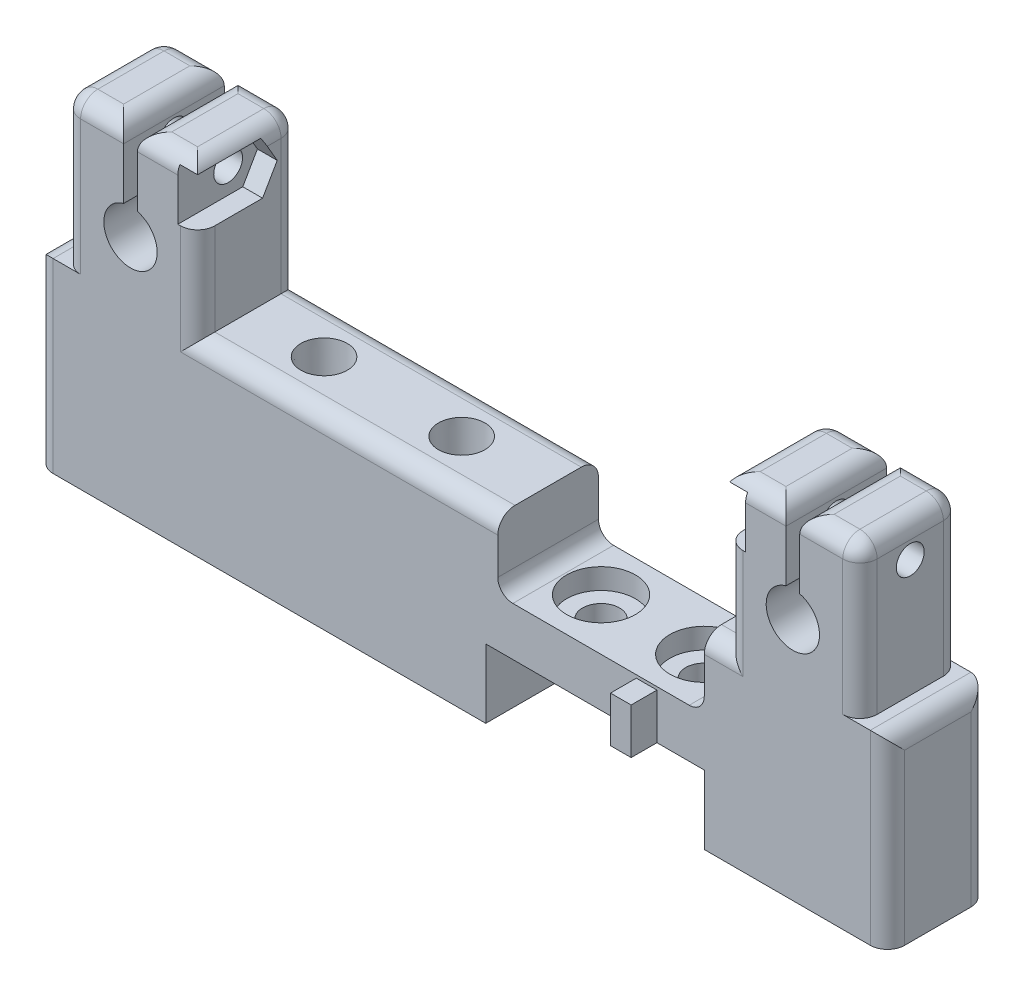
from build123d import *
from OCP.BRepFilletAPI import BRepFilletAPI_MakeChamfer
from build123d.topology import SkipClean

# Parameters (mm, degrees)
SKETCH1_R                      = 3.1
SKETCH1_R_2                    = 3.5
SKETCH1_W                      = 32
SKETCH1_H                      = 15.65
BOSS_EXTRUDE1_DEPTH            = 11.7
CUT_EXTRUDE5_DEPTH             = 14
CUT_EXTRUDE8_REACH             = 96.23
SKETCH10_R                     = 1.675
CUT_EXTRUDE8_DIRECTION_2_REACH = 96.23
CUT_EXTRUDE9_REACH             = 94.724
SKETCH11_R                     = 1.625
CUT_EXTRUDE9_DIRECTION_2_REACH = 94.724
CUT_EXTRUDE10_DEPTH            = 2.3
CUT_EXTRUDE11_DEPTH            = 2.3
HOLE1_D                        = 4.8
HOLE1_DEPTH                    = 12
HOLE1_CBORE_D                  = 5.4
HOLE1_CBORE_DEPTH              = 6
CUT_EXTRUDE17_REACH            = 66.001
SKETCH30_W                     = 59.4
SKETCH30_H                     = 25.65
SKETCH32_W                     = 99
SKETCH32_H                     = 8
CUT_EXTRUDE20_DEPTH            = 65.000566
CHAMFER1_SIZE                  = 6
CHAMFER1_SIZE_2                = 0.3
FILLET1_R                      = 2
SKETCH33_W                     = 2.4
SKETCH33_H                     = 5.3
BOSS_EXTRUDE2_DEPTH            = 3
SKETCH34_W                     = 99
SKETCH34_H                     = 8
CUT_EXTRUDE21_DEPTH            = 61.759087
CUT_EXTRUDE22_START            = -11.7
CUT_EXTRUDE22_DEPTH            = 11.7
BOSS_EXTRUDE4_DEPTH            = 8
SKETCH45_W                     = 25.4
SKETCH45_H                     = 8
CUT_EXTRUDE26_DEPTH            = 62.407383
M4_CLEARANCE_HOLE1_D           = 4.3
SKETCH46_2_R                   = 4
CUT_EXTRUDE27_DEPTH            = 2.4
FILLET5_R                      = 1.75


# Some blends are built 0.0001 mm under size
with BuildPart() as part:
    # Sketch1 → Boss-Extrude1 (new body)
    with BuildSketch(Plane.XY):
        Polygon((-43.30318, 29.275361), (25.69682, 29.275361), (55.69682, 29.275361), (55.69682, -18.024639), (-43.30318, -18.024639), align=None)
        with Locations((-32.30318, 10.275361)):
            Circle(SKETCH1_R, mode=Mode.SUBTRACT)
        with Locations((44.69682, 10.275361)):
            Circle(SKETCH1_R, mode=Mode.SUBTRACT)
        with Locations((22.69682, 12.275361)):
            Circle(SKETCH1_R_2, mode=Mode.SUBTRACT)
        with Locations((-6.80318, 11.450361)):
            Rectangle(SKETCH1_W, SKETCH1_H, mode=Mode.SUBTRACT)
    extrude(amount=-BOSS_EXTRUDE1_DEPTH)

    # Sketch7 → Cut-Extrude5 (cut)
    with BuildSketch(Plane.XY):
        with BuildLine():
            Line((-43.30318, 22.775361), (-22.50318, 22.775361))
            Line((-22.50318, 22.775361), (-22.50318, 3.625361))
            Line((-22.50318, 3.625361), (-24.50318, 3.625361))
            Line((-24.50318, 3.625361), (-24.50318, 21.275361))
            Line((-24.50318, 21.275361), (-31.50318, 21.275361))
            Line((-31.50318, 21.275361), (-31.50318, 13.270357))
            ThreePointArc((-31.50318, 13.270357), (-32.30318, 7.175361), (-33.10318, 13.270357))
            Line((-33.10318, 13.270357), (-33.10318, 21.275361))
            Line((-33.10318, 21.275361), (-40.10318, 21.275361))
            Line((-40.10318, 21.275361), (-40.10318, 3.625361))
            Line((-40.10318, 3.625361), (-43.30318, 3.625361))
            Line((-43.30318, 3.625361), (-43.30318, 22.775361))
        make_face()
        with BuildLine():
            Line((34.89682, 22.775361), (55.69682, 22.775361))
            Line((55.69682, 22.775361), (55.69682, 3.625361))
            Line((55.69682, 3.625361), (52.49682, 3.625361))
            Line((52.49682, 3.625361), (52.49682, 21.275361))
            Line((52.49682, 21.275361), (45.49682, 21.275361))
            Line((45.49682, 21.275361), (45.49682, 13.270357))
            ThreePointArc((45.49682, 13.270357), (44.69682, 7.175361), (43.89682, 13.270357))
            Line((43.89682, 13.270357), (43.89682, 21.275361))
            Line((43.89682, 21.275361), (36.89682, 21.275361))
            Line((36.89682, 21.275361), (36.89682, 3.625361))
            Line((36.89682, 3.625361), (34.89682, 3.625361))
            Line((34.89682, 3.625361), (34.89682, 22.775361))
        make_face()
    extrude(amount=-CUT_EXTRUDE5_DEPTH, mode=Mode.SUBTRACT)

    # Sketch10 → Cut-Extrude8 (cut, up to next)
    with BuildSketch(Plane(origin=(-33.10318, 0, 0), x_dir=(0, 0, -1), z_dir=(1, 0, 0)), mode=Mode.PRIVATE) as cut_extrude8_sk1:
        with Locations(Location((5.85, 17.272859, 0), (0, 0, 270))):
            Circle(SKETCH10_R)
    cut_extrude8_tool1 = extrude(cut_extrude8_sk1.sketch, amount=-CUT_EXTRUDE8_REACH, mode=Mode.PRIVATE) & part.part
    add(cut_extrude8_tool1.solids().sort_by_distance((-33.10318, 17.272859, -5.85))[0], mode=Mode.SUBTRACT)

    # Sketch10 → Cut-Extrude8 direction 2 (cut, up to next)
    with BuildSketch(Plane(origin=(-33.10318, 0, 0), x_dir=(0, 0, -1), z_dir=(1, 0, 0)), mode=Mode.PRIVATE) as cut_extrude8_direction_2_sk1:
        with Locations(Location((5.85, 17.272859, 0), (0, 0, 270))):
            Circle(SKETCH10_R)
    cut_extrude8_direction_2_tool1 = extrude(cut_extrude8_direction_2_sk1.sketch, amount=CUT_EXTRUDE8_DIRECTION_2_REACH, mode=Mode.PRIVATE) & part.part
    add(cut_extrude8_direction_2_tool1.solids().sort_by_distance((-33.10318, 17.272859, -5.85))[0], mode=Mode.SUBTRACT)

    # Sketch11 → Cut-Extrude9 (cut, up to next)
    with BuildSketch(Plane(origin=(43.89682, 0, 0), x_dir=(0, 0, -1), z_dir=(1, 0, 0)), mode=Mode.PRIVATE) as cut_extrude9_sk1:
        with Locations(Location((5.85, 17.272859, 0), (0, 0, 180))):
            Circle(SKETCH11_R)
    cut_extrude9_tool1 = extrude(cut_extrude9_sk1.sketch, amount=-CUT_EXTRUDE9_REACH, mode=Mode.PRIVATE) & part.part
    add(cut_extrude9_tool1.solids().sort_by_distance((43.89682, 17.272859, -5.85))[0], mode=Mode.SUBTRACT)

    # Sketch11 → Cut-Extrude9 direction 2 (cut, up to next)
    with BuildSketch(Plane(origin=(43.89682, 0, 0), x_dir=(0, 0, -1), z_dir=(1, 0, 0)), mode=Mode.PRIVATE) as cut_extrude9_direction_2_sk1:
        with Locations(Location((5.85, 17.272859, 0), (0, 0, 180))):
            Circle(SKETCH11_R)
    cut_extrude9_direction_2_tool1 = extrude(cut_extrude9_direction_2_sk1.sketch, amount=CUT_EXTRUDE9_DIRECTION_2_REACH, mode=Mode.PRIVATE) & part.part
    add(cut_extrude9_direction_2_tool1.solids().sort_by_distance((43.89682, 17.272859, -5.85))[0], mode=Mode.SUBTRACT)

    # Sketch12 → Cut-Extrude10 (cut)
    with BuildSketch(Plane.ZY.offset(-36.89682)):
        Polygon((-4.146817, 20.222859), (0, 20.222859), (0, 14.322859), (-4.146817, 14.322859), (-7.553183, 14.322859), (-9.256367, 17.272859), (-7.553183, 20.222859), align=None)
    extrude(amount=-CUT_EXTRUDE10_DEPTH, mode=Mode.SUBTRACT)

    # Sketch13 → Cut-Extrude11 (cut)
    with BuildSketch(Plane(origin=(-24.50318, 0, 0), x_dir=(0, 0, -1), z_dir=(1, 0, 0))):
        Polygon((4.146817, 20.222859), (0, 20.222859), (0, 14.322859), (4.146817, 14.322859), (7.553183, 14.322859), (9.256367, 17.272859), (7.553183, 20.222859), align=None)
    extrude(amount=-CUT_EXTRUDE11_DEPTH, mode=Mode.SUBTRACT)

    # Hole1
    with Locations(Plane(origin=(0, 3.625361, 0), x_dir=(1, 0, 0), z_dir=(0, 1, 0))):
        with Locations((-15.65318, 5.85), (0.34682, 5.85)):
            CounterBoreHole(HOLE1_D / 2, HOLE1_CBORE_D / 2, HOLE1_CBORE_DEPTH, depth=HOLE1_DEPTH)

    # Sketch30 → Cut-Extrude17 (cut, up to next)
    with BuildSketch(Plane(origin=(0, 0, -11.7), x_dir=(-1, 0, 0), z_dir=(0, 0, -1)), mode=Mode.PRIVATE) as cut_extrude17_sk1:
        with Locations((-5.19682, 16.450361)):
            Rectangle(SKETCH30_W, SKETCH30_H)
    cut_extrude17_tool1 = extrude(cut_extrude17_sk1.sketch, amount=-CUT_EXTRUDE17_REACH, mode=Mode.PRIVATE) & part.part
    add(cut_extrude17_tool1.solids().sort_by_distance((5.19682, 16.450361, -11.7))[0], mode=Mode.SUBTRACT)


with BuildPart() as cut_extrude17_piece_1:
    # of the separate pieces the step leaves, piece 1, a body of its own (cut_extrude17_pieces)
    add(part.part.solids().sort_by_distance((-24.50318, 3.625361, 0))[0])

    # Chamfer1
    chamfer1_edges_1 = [cut_extrude17_piece_1.edges().sort_by_distance(p)[0] for p in [
        (-2.35318, -2.374639, -5.85),
    ]]
    chamfer1_side_1 = [cut_extrude17_piece_1.faces().sort_by_distance(p)[0] for p in [
        (-2.35318, -2.368639, -5.85),
    ]]
    chamfer1_edges_2 = [cut_extrude17_piece_1.edges().sort_by_distance(p)[0] for p in [
        (-18.35318, -2.374639, -5.85),
    ]]
    chamfer1_side_2 = [cut_extrude17_piece_1.faces().sort_by_distance(p)[0] for p in [
        (-18.35318, -2.368639, -5.85),
    ]]
    chamfer1 = BRepFilletAPI_MakeChamfer(cut_extrude17_piece_1.part.solid().wrapped)
    for e in chamfer1_edges_1:
        chamfer1.Add(CHAMFER1_SIZE - 0.0001, CHAMFER1_SIZE_2 - 0.0001, e.wrapped, chamfer1_side_1[0].wrapped)
    for e in chamfer1_edges_2:
        chamfer1.Add(CHAMFER1_SIZE - 0.0001, CHAMFER1_SIZE_2 - 0.0001, e.wrapped, chamfer1_side_2[0].wrapped)
    add(Compound.cast(chamfer1.Shape()), mode=Mode.REPLACE)  # a hair under: the kernel refuses the full size

    # Fillet1
    # the kernel refuses this fillet: 2 mm, written as the material it takes off along each edge
    with BuildSketch(Plane(origin=(50.49682, 19.275361, -2), x_dir=(1, 0, 0), z_dir=(0, 1, 0))) as fillet1_piece_1_section:
        Polygon((0, 0), (FILLET1_R, 0), (FILLET1_R, -FILLET1_R), (0, -FILLET1_R), align=None)
    fillet1_piece_1 = extrude(amount=FILLET1_R, mode=Mode.PRIVATE)
    fillet1_piece_1 = fillet1_piece_1 - Plane(origin=(50.49682, 19.275361, -2), x_dir=(-0.7071067811865475, 0, -0.7071067811865475), z_dir=(0, 1, 0)) * Sphere(FILLET1_R, mode=Mode.PRIVATE)
    add(fillet1_piece_1, mode=Mode.SUBTRACT)
    with BuildSketch(Plane(origin=(50.49682, 19.275361, -9.7), x_dir=(1, 0, 0), z_dir=(0, 1, 0))) as fillet1_piece_2_section:
        Polygon((0, 0), (FILLET1_R, 0), (FILLET1_R, FILLET1_R), (0, FILLET1_R), align=None)
    fillet1_piece_2 = extrude(amount=FILLET1_R, mode=Mode.PRIVATE)
    fillet1_piece_2 = fillet1_piece_2 - Plane(origin=(50.49682, 19.275361, -9.7), x_dir=(-0.7071067811865475, 0, 0.7071067811865475), z_dir=(0, 1, 0)) * Sphere(FILLET1_R, mode=Mode.PRIVATE)
    add(fillet1_piece_2, mode=Mode.SUBTRACT)
    with BuildSketch(Plane(origin=(38.89682, 19.275361, -9.7), x_dir=(-1, 0, 0), z_dir=(0, 0, -1))) as fillet1_piece_3_section:
        Polygon((0, 0), (FILLET1_R, 0), (FILLET1_R, FILLET1_R), (0, FILLET1_R), align=None)
    fillet1_piece_3 = extrude(amount=FILLET1_R, mode=Mode.PRIVATE)
    fillet1_piece_3 = fillet1_piece_3 - Plane(origin=(38.89682, 19.275361, -9.7), x_dir=(0.7071067811865475, -0.7071067811865475, 0), z_dir=(0, 0, -1)) * Sphere(FILLET1_R, mode=Mode.PRIVATE)
    add(fillet1_piece_3, mode=Mode.SUBTRACT)
    with BuildSketch(Plane(origin=(-38.10318, 19.275361, -2), x_dir=(0, 1, 0), z_dir=(-1, 0, 0))) as fillet1_piece_4_section:
        Polygon((0, 0), (FILLET1_R, 0), (FILLET1_R, -FILLET1_R), (0, -FILLET1_R), align=None)
    fillet1_piece_4 = extrude(amount=FILLET1_R, mode=Mode.PRIVATE)
    fillet1_piece_4 = fillet1_piece_4 - Plane(origin=(-38.10318, 19.275361, -2), x_dir=(0, -0.7071067811865475, -0.7071067811865475), z_dir=(-1, 0, 0)) * Sphere(FILLET1_R, mode=Mode.PRIVATE)
    add(fillet1_piece_4, mode=Mode.SUBTRACT)
    with BuildSketch(Plane(origin=(-38.10318, 19.275361, -9.7), x_dir=(0, 1, 0), z_dir=(-1, 0, 0))) as fillet1_piece_5_section:
        Polygon((0, 0), (FILLET1_R, 0), (FILLET1_R, FILLET1_R), (0, FILLET1_R), align=None)
    fillet1_piece_5 = extrude(amount=FILLET1_R, mode=Mode.PRIVATE)
    fillet1_piece_5 = fillet1_piece_5 - Plane(origin=(-38.10318, 19.275361, -9.7), x_dir=(0, -0.7071067811865475, 0.7071067811865475), z_dir=(-1, 0, 0)) * Sphere(FILLET1_R, mode=Mode.PRIVATE)
    add(fillet1_piece_5, mode=Mode.SUBTRACT)
    with BuildSketch(Plane(origin=(-26.50318, 19.275361, -9.7), x_dir=(0, 0, -1), z_dir=(1, 0, 0))) as fillet1_piece_6_section:
        Polygon((0, 0), (FILLET1_R, 0), (FILLET1_R, FILLET1_R), (0, FILLET1_R), align=None)
    fillet1_piece_6 = extrude(amount=FILLET1_R, mode=Mode.PRIVATE)
    fillet1_piece_6 = fillet1_piece_6 - Plane(origin=(-26.50318, 19.275361, -9.7), x_dir=(0, -0.7071067811865475, 0.7071067811865475), z_dir=(1, 0, 0)) * Sphere(FILLET1_R, mode=Mode.PRIVATE)
    add(fillet1_piece_6, mode=Mode.SUBTRACT)
    with BuildSketch(Plane(origin=(52.49682, 21.275361, -2), x_dir=(-1, 0, 0), z_dir=(0, 0, -1)), Plane(origin=(-40.10318, 21.275361, -2), x_dir=(0, -1, 0), z_dir=(0, 0, -1))) as fillet1_piece_7:
        with BuildLine():
            CenterArc((FILLET1_R, -FILLET1_R), FILLET1_R, 90, 90)
            Line((0, -FILLET1_R), (0, 0))
            Line((0, 0), (FILLET1_R, 0))
        make_face()
    extrude(amount=7.7, mode=Mode.SUBTRACT)
    with BuildSketch(Plane(origin=(50.49682, 21.275361, 0), x_dir=(0, -1, 0), z_dir=(-1, 0, 0)), Plane(origin=(40.49682, 21.275361, -11.7), x_dir=(0, -1, 0), z_dir=(1, 0, 0)), Plane(origin=(38.89682, 21.275361, -11.7), x_dir=(0, -1, 0), z_dir=(1, 0, 0)), Plane(origin=(-28.10318, 21.275361, 0), x_dir=(0, -1, 0), z_dir=(-1, 0, 0)), Plane(origin=(-38.10318, 21.275361, -11.7), x_dir=(0, -1, 0), z_dir=(1, 0, 0)), Plane(origin=(-36.50318, 21.275361, -11.7), x_dir=(0, -1, 0), z_dir=(1, 0, 0))) as fillet1_piece_8:
        with BuildLine():
            CenterArc((FILLET1_R, -FILLET1_R), FILLET1_R, 90, 90)
            Line((0, -FILLET1_R), (0, 0))
            Line((0, 0), (FILLET1_R, 0))
        make_face()
    extrude(amount=10, mode=Mode.SUBTRACT)
    with BuildSketch(Plane(origin=(45.49682, 21.275361, 5), x_dir=(0, -1, 0), z_dir=(0, 0, -1)), Plane(origin=(43.89682, 21.275361, 5), x_dir=(-1, 0, 0), z_dir=(0, 0, -1)), Plane(origin=(-33.10318, 21.275361, 5), x_dir=(-1, 0, 0), z_dir=(0, 0, -1)), Plane(origin=(55.69682, 3.625361, 5), x_dir=(-1, 0, 0), z_dir=(0, 0, -1)), Plane(origin=(-43.30318, 3.625361, 5), x_dir=(0, -1, 0), z_dir=(0, 0, -1))) as fillet1_piece_9:
        with BuildLine():
            CenterArc((FILLET1_R, -FILLET1_R), FILLET1_R, 90, 90)
            Line((0, -FILLET1_R), (0, 0))
            Line((0, 0), (FILLET1_R, 0))
        make_face()
    extrude(amount=21.7, mode=Mode.SUBTRACT)
    with BuildSketch(Plane(origin=(48.89682, 21.275361, 0), x_dir=(0, -1, 0), z_dir=(-1, 0, 0)), Plane(origin=(-19.50318, 21.275361, 0), x_dir=(0, -1, 0), z_dir=(-1, 0, 0))) as fillet1_piece_10:
        with BuildLine():
            CenterArc((FILLET1_R, -FILLET1_R), FILLET1_R, 90, 90)
            Line((0, -FILLET1_R), (0, 0))
            Line((0, 0), (FILLET1_R, 0))
        make_face()
    extrude(amount=17, mode=Mode.SUBTRACT)
    with BuildSketch(Plane(origin=(36.89682, 21.275361, 5), x_dir=(0, -1, 0), z_dir=(0, 0, -1))) as fillet1_piece_11:
        with BuildLine():
            CenterArc((FILLET1_R, -FILLET1_R), FILLET1_R, 90, 90)
            Line((0, -FILLET1_R), (0, 0))
            Line((0, 0), (FILLET1_R, 0))
        make_face()
    extrude(amount=14.7, mode=Mode.SUBTRACT)
    with BuildSketch(Plane(origin=(-24.50318, 21.275361, 5), x_dir=(0, -1, 0), z_dir=(0, 0, -1))) as fillet1_piece_12:
        with BuildLine():
            CenterArc((FILLET1_R, FILLET1_R), FILLET1_R, 180, 90)
            Line((0, FILLET1_R), (0, 0))
            Line((0, 0), (FILLET1_R, 0))
        make_face()
    extrude(amount=14.7, mode=Mode.SUBTRACT)
    with BuildSketch(Plane(origin=(-31.50318, 21.275361, 5), x_dir=(1, 0, 0), z_dir=(0, 0, -1))) as fillet1_piece_13:
        with BuildLine():
            CenterArc((FILLET1_R, FILLET1_R), FILLET1_R, 180, 90)
            Line((0, FILLET1_R), (0, 0))
            Line((0, 0), (FILLET1_R, 0))
        make_face()
    extrude(amount=21.7, mode=Mode.SUBTRACT)
    with BuildSketch(Plane(origin=(55.69682, 8.625361, 0), x_dir=(-1, 0, 0), z_dir=(0, -1, 0)), Plane(origin=(-43.30318, -23.024639, 0), x_dir=(1, 0, 0), z_dir=(0, 1, 0))) as fillet1_piece_14:
        with BuildLine():
            CenterArc((FILLET1_R, FILLET1_R), FILLET1_R, 180, 90)
            Line((0, FILLET1_R), (0, 0))
            Line((0, 0), (FILLET1_R, 0))
        make_face()
    extrude(amount=31.65, mode=Mode.SUBTRACT)
    with BuildSketch(Plane(origin=(55.69682, 8.625361, -11.7), x_dir=(-1, 0, 0), z_dir=(0, -1, 0)), Plane(origin=(-43.30318, -23.024639, -11.7), x_dir=(1, 0, 0), z_dir=(0, 1, 0))) as fillet1_piece_15:
        with BuildLine():
            CenterArc((FILLET1_R, -FILLET1_R), FILLET1_R, 90, 90)
            Line((0, -FILLET1_R), (0, 0))
            Line((0, 0), (FILLET1_R, 0))
        make_face()
    extrude(amount=31.65, mode=Mode.SUBTRACT)
    with BuildSketch(Plane(origin=(36.89682, 3.625361, -11.7), x_dir=(0, 0, 1), z_dir=(-1, 0, 0))) as fillet1_piece_16:
        with BuildLine():
            CenterArc((FILLET1_R, -FILLET1_R), FILLET1_R, 90, 90)
            Line((0, -FILLET1_R), (0, 0))
            Line((0, 0), (FILLET1_R, 0))
        make_face()
    extrude(amount=61.4, mode=Mode.SUBTRACT)
    with BuildSketch(Plane(origin=(36.89682, 3.625361, 0), x_dir=(0, 0, -1), z_dir=(-1, 0, 0))) as fillet1_piece_17:
        with BuildLine():
            CenterArc((FILLET1_R, FILLET1_R), FILLET1_R, 180, 90)
            Line((0, FILLET1_R), (0, 0))
            Line((0, 0), (FILLET1_R, 0))
        make_face()
    extrude(amount=61.4, mode=Mode.SUBTRACT)
    with BuildSketch(Plane(origin=(36.89682, 19.322859, 0), x_dir=(0, 0, -1), z_dir=(0, -1, 0)), Plane(origin=(-24.50318, 3.625361, 0), x_dir=(0, 0, -1), z_dir=(0, 1, 0))) as fillet1_piece_18:
        with BuildLine():
            CenterArc((FILLET1_R, FILLET1_R), FILLET1_R, 180, 90)
            Line((0, FILLET1_R), (0, 0))
            Line((0, 0), (FILLET1_R, 0))
        make_face()
    extrude(amount=15.697498, mode=Mode.SUBTRACT)
    with BuildSketch(Plane(origin=(52.49682, 3.625361, 0), x_dir=(-1, 0, 0), z_dir=(0, 1, 0)), Plane(origin=(36.89682, 3.625361, -11.7), x_dir=(1, 0, 0), z_dir=(0, 1, 0)), Plane(origin=(52.49682, 19.275361, -11.7), x_dir=(-1, 0, 0), z_dir=(0, -1, 0)), Plane(origin=(-40.10318, 19.275361, 0), x_dir=(1, 0, 0), z_dir=(0, -1, 0)), Plane(origin=(-40.10318, 3.625361, -11.7), x_dir=(1, 0, 0), z_dir=(0, 1, 0))) as fillet1_piece_19:
        with BuildLine():
            CenterArc((FILLET1_R, -FILLET1_R), FILLET1_R, 90, 90)
            Line((0, -FILLET1_R), (0, 0))
            Line((0, 0), (FILLET1_R, 0))
        make_face()
    extrude(amount=15.65, mode=Mode.SUBTRACT)
    with BuildSketch(Plane(origin=(-24.50318, 19.275361, -11.7), x_dir=(0, 0, 1), z_dir=(0, -1, 0))) as fillet1_piece_20:
        with BuildLine():
            CenterArc((FILLET1_R, FILLET1_R), FILLET1_R, 180, 90)
            Line((0, FILLET1_R), (0, 0))
            Line((0, 0), (FILLET1_R, 0))
        make_face()
    extrude(amount=15.65, mode=Mode.SUBTRACT)
    with BuildSketch(Plane(origin=(41.89682, 3.625361, -11.7), x_dir=(0, 0, 1), z_dir=(-1, 0, 0))) as fillet1_piece_21a_section:
        with BuildLine():
            CenterArc((FILLET1_R, -FILLET1_R), FILLET1_R, 90, 90)
            Line((0, -FILLET1_R), (0, 0))
            Line((0, 0), (FILLET1_R, 0))
        make_face()
    fillet1_piece_21a = extrude(amount=66.4, mode=Mode.PRIVATE)
    fillet1_piece_21a = split(fillet1_piece_21a, bisect_by=Plane(origin=(36.89682, 3.172571, -11.24721), z_dir=(1, 0, 0)), keep=Keep.TOP, mode=Mode.PRIVATE)
    with BuildSketch(Plane(origin=(36.89682, -1.374639, -11.7), x_dir=(1, 0, 0), z_dir=(0, 1, 0))) as fillet1_piece_21b_section:
        with BuildLine():
            CenterArc((FILLET1_R, -FILLET1_R), FILLET1_R, 90, 90)
            Line((0, -FILLET1_R), (0, 0))
            Line((0, 0), (FILLET1_R, 0))
        make_face()
    fillet1_piece_21b = extrude(amount=20.65, mode=Mode.PRIVATE)
    fillet1_piece_21b = split(fillet1_piece_21b, bisect_by=Plane(origin=(37.34961, 3.625361, -11.24721), z_dir=(0, -1, 0)), keep=Keep.TOP, mode=Mode.PRIVATE)
    fillet1_piece_21 = fillet1_piece_21a & fillet1_piece_21b
    add(fillet1_piece_21, mode=Mode.SUBTRACT)
    with BuildSketch(Plane(origin=(36.89682, 3.625361, -11.7), x_dir=(0, 0, 1), z_dir=(-1, 0, 0))) as fillet1_piece_22a_section:
        with BuildLine():
            CenterArc((FILLET1_R, -FILLET1_R), FILLET1_R, 90, 90)
            Line((0, -FILLET1_R), (0, 0))
            Line((0, 0), (FILLET1_R, 0))
        make_face()
    fillet1_piece_22a = extrude(amount=66.4, mode=Mode.PRIVATE)
    fillet1_piece_22a = split(fillet1_piece_22a, bisect_by=Plane(origin=(-24.50318, 3.172571, -11.24721), z_dir=(-1, 0, 0)), keep=Keep.TOP, mode=Mode.PRIVATE)
    with BuildSketch(Plane(origin=(-24.50318, 19.275361, -11.7), x_dir=(0, 0, 1), z_dir=(0, -1, 0))) as fillet1_piece_22b_section:
        with BuildLine():
            CenterArc((FILLET1_R, FILLET1_R), FILLET1_R, 180, 90)
            Line((0, FILLET1_R), (0, 0))
            Line((0, 0), (FILLET1_R, 0))
        make_face()
    fillet1_piece_22b = extrude(amount=20.65, mode=Mode.PRIVATE)
    fillet1_piece_22b = split(fillet1_piece_22b, bisect_by=Plane(origin=(-24.955971, 3.625361, -11.24721), z_dir=(0, -1, 0)), keep=Keep.TOP, mode=Mode.PRIVATE)
    fillet1_piece_22 = fillet1_piece_22a & fillet1_piece_22b
    add(fillet1_piece_22, mode=Mode.SUBTRACT)
    with BuildSketch(Plane(origin=(41.89682, 3.625361, 0), x_dir=(0, 0, -1), z_dir=(-1, 0, 0))) as fillet1_piece_23a_section:
        with BuildLine():
            CenterArc((FILLET1_R, FILLET1_R), FILLET1_R, 180, 90)
            Line((0, FILLET1_R), (0, 0))
            Line((0, 0), (FILLET1_R, 0))
        make_face()
    fillet1_piece_23a = extrude(amount=66.4, mode=Mode.PRIVATE)
    fillet1_piece_23a = split(fillet1_piece_23a, bisect_by=Plane(origin=(36.89682, 3.172571, -0.45279), z_dir=(1, 0, 0)), keep=Keep.TOP, mode=Mode.PRIVATE)
    with BuildSketch(Plane(origin=(36.89682, 19.322859, 0), x_dir=(0, 0, -1), z_dir=(0, -1, 0))) as fillet1_piece_23b_section:
        with BuildLine():
            CenterArc((FILLET1_R, FILLET1_R), FILLET1_R, 180, 90)
            Line((0, FILLET1_R), (0, 0))
            Line((0, 0), (FILLET1_R, 0))
        make_face()
    fillet1_piece_23b = extrude(amount=20.697498, mode=Mode.PRIVATE)
    fillet1_piece_23b = split(fillet1_piece_23b, bisect_by=Plane(origin=(37.34961, 3.625361, -0.45279), z_dir=(0, -1, 0)), keep=Keep.TOP, mode=Mode.PRIVATE)
    fillet1_piece_23 = fillet1_piece_23a & fillet1_piece_23b
    add(fillet1_piece_23, mode=Mode.SUBTRACT)
    with BuildSketch(Plane(origin=(36.89682, 3.625361, 0), x_dir=(0, 0, -1), z_dir=(-1, 0, 0))) as fillet1_piece_24a_section:
        with BuildLine():
            CenterArc((FILLET1_R, FILLET1_R), FILLET1_R, 180, 90)
            Line((0, FILLET1_R), (0, 0))
            Line((0, 0), (FILLET1_R, 0))
        make_face()
    fillet1_piece_24a = extrude(amount=66.4, mode=Mode.PRIVATE)
    fillet1_piece_24a = split(fillet1_piece_24a, bisect_by=Plane(origin=(-24.50318, 3.172571, -0.45279), z_dir=(-1, 0, 0)), keep=Keep.TOP, mode=Mode.PRIVATE)
    with BuildSketch(Plane(origin=(-24.50318, -1.374639, 0), x_dir=(0, 0, -1), z_dir=(0, 1, 0))) as fillet1_piece_24b_section:
        with BuildLine():
            CenterArc((FILLET1_R, FILLET1_R), FILLET1_R, 180, 90)
            Line((0, FILLET1_R), (0, 0))
            Line((0, 0), (FILLET1_R, 0))
        make_face()
    fillet1_piece_24b = extrude(amount=20.697498, mode=Mode.PRIVATE)
    fillet1_piece_24b = split(fillet1_piece_24b, bisect_by=Plane(origin=(-24.955971, 3.625361, -0.45279), z_dir=(0, -1, 0)), keep=Keep.TOP, mode=Mode.PRIVATE)
    fillet1_piece_24 = fillet1_piece_24a & fillet1_piece_24b
    add(fillet1_piece_24, mode=Mode.SUBTRACT)

    # Sketch33 → Boss-Extrude2 (add)
    with BuildSketch(Plane.XY):
        with Locations((27.69682, -7.374639)):
            Rectangle(SKETCH33_W, SKETCH33_H)
    extrude(amount=BOSS_EXTRUDE2_DEPTH)

    # Sketch34 → Cut-Extrude21 (cut, through all)
    with BuildSketch(Plane.XY):
        with Locations((6.19682, -14.024639)):
            Rectangle(SKETCH34_W, SKETCH34_H)
    extrude(amount=-CUT_EXTRUDE21_DEPTH, mode=Mode.SUBTRACT)

    # Sketch35 → Cut-Extrude22 (cut)
    with BuildSketch(Plane.XY.offset(CUT_EXTRUDE22_START)):
        Polygon((17.39682, 3.625361), (28.359066, 3.625361), (34.39682, 3.625361), (34.39682, -4.374639), (10.39682, -4.374639), (10.39682, 1.625361), (10.39682, 3.625361), align=None)
    extrude(amount=CUT_EXTRUDE22_DEPTH, mode=Mode.SUBTRACT)

    # Sketch36 → Boss-Extrude4 (add)
    with SkipClean():  # the faces are left unmerged after this step: merging them gives an invalid solid
        with BuildSketch(Plane.XZ.offset(10.024639)):
            with BuildLine():
                Line((26.49682, 3), (26.49682, 0))
                Line((26.49682, 0), (-41.30318, 0))
                ThreePointArc((-41.30318, 0), (-42.717394, -0.585786), (-43.30318, -2))
                Line((-43.30318, -2), (-43.30318, -9.7))
                ThreePointArc((-43.30318, -9.7), (-42.717394, -11.114214), (-41.30318, -11.7))
                Line((-41.30318, -11.7), (53.69682, -11.7))
                ThreePointArc((53.69682, -11.7), (55.111033, -11.114214), (55.69682, -9.7))
                Line((55.69682, -9.7), (55.69682, -2))
                ThreePointArc((55.69682, -2), (55.111033, -0.585786), (53.69682, 0))
                Line((53.69682, 0), (28.89682, 0))
                Line((28.89682, 0), (28.89682, 3))
                Line((28.89682, 3), (26.49682, 3))
            make_face()
        extrude(amount=BOSS_EXTRUDE4_DEPTH)

    # Sketch45 → Cut-Extrude26 (cut, through all)
    with SkipClean():  # the faces are left unmerged after this step: merging them gives an invalid solid
        with BuildSketch(Plane(origin=(0, 0, -11.7), x_dir=(-1, 0, 0), z_dir=(0, 0, -1))):
            with Locations((-21.69682, -14.024639)):
                Rectangle(SKETCH45_W, SKETCH45_H)
        extrude(amount=-CUT_EXTRUDE26_DEPTH, mode=Mode.SUBTRACT)

    # M4 Clearance Hole1 (through all)
    with Locations(Plane(origin=(0, -4.374639, 0), x_dir=(1, 0, 0), z_dir=(0, 1, 0))):
        with Locations((16.39682, 6), (28.39682, 6)):
            Hole(M4_CLEARANCE_HOLE1_D / 2)

    # Sketch46<2> → Cut-Extrude27 (cut)
    with SkipClean():  # the faces are left unmerged after this step: merging them gives an invalid solid
        with BuildSketch(Plane(origin=(0, -4.374639, 0), x_dir=(1, 0, 0), z_dir=(0, 1, 0))):
            with Locations(Location((16.39682, 6, 0), (0, 0, 270))):
                Circle(SKETCH46_2_R)
            with Locations(Location((28.39682, 6, 0), (0, 0, 270))):
                Circle(SKETCH46_2_R)
        extrude(amount=-CUT_EXTRUDE27_DEPTH, mode=Mode.SUBTRACT)

    # Fillet5
    fillet5_edges = [cut_extrude17_piece_1.edges().sort_by_distance(p)[0] for p in [
        (10.39682, -4.374639, -5.85),
        (34.39682, -4.374639, -5.85),
    ]]
    fillet(fillet5_edges, radius=FILLET5_R)


with BuildPart() as cut_extrude17_piece_2:
    # of the separate pieces the step leaves, piece 2, a body of its own (cut_extrude17_pieces)
    add(part.part.solids().sort_by_distance((34.89682, 29.275361, 0))[0])


with BuildPart() as cut_extrude17_piece_3:
    # of the separate pieces the step leaves, piece 3, a body of its own (cut_extrude17_pieces)
    add(part.part.solids().sort_by_distance((-43.30318, 29.275361, 0))[0])


with BuildPart() as cut_extrude20_tool:
    # Sketch32 → Cut-Extrude20 (new, through all)
    with BuildSketch(Plane(origin=(0, 0, -11.7), x_dir=(-1, 0, 0), z_dir=(0, 0, -1))):
        with Locations((-6.19682, 25.275361)):
            Rectangle(SKETCH32_W, SKETCH32_H)
    extrude(amount=-CUT_EXTRUDE20_DEPTH)


with BuildPart() as cut_extrude17_piece_2_1:
    add(cut_extrude17_piece_2.part)

    # Cut-Extrude20: cut by cut_extrude20_tool
    add(cut_extrude20_tool.part, mode=Mode.SUBTRACT)


with BuildPart() as cut_extrude17_piece_3_1:
    add(cut_extrude17_piece_3.part)

    # Cut-Extrude20: cut by cut_extrude20_tool
    add(cut_extrude20_tool.part, mode=Mode.SUBTRACT)


solid = cut_extrude17_piece_1.part
